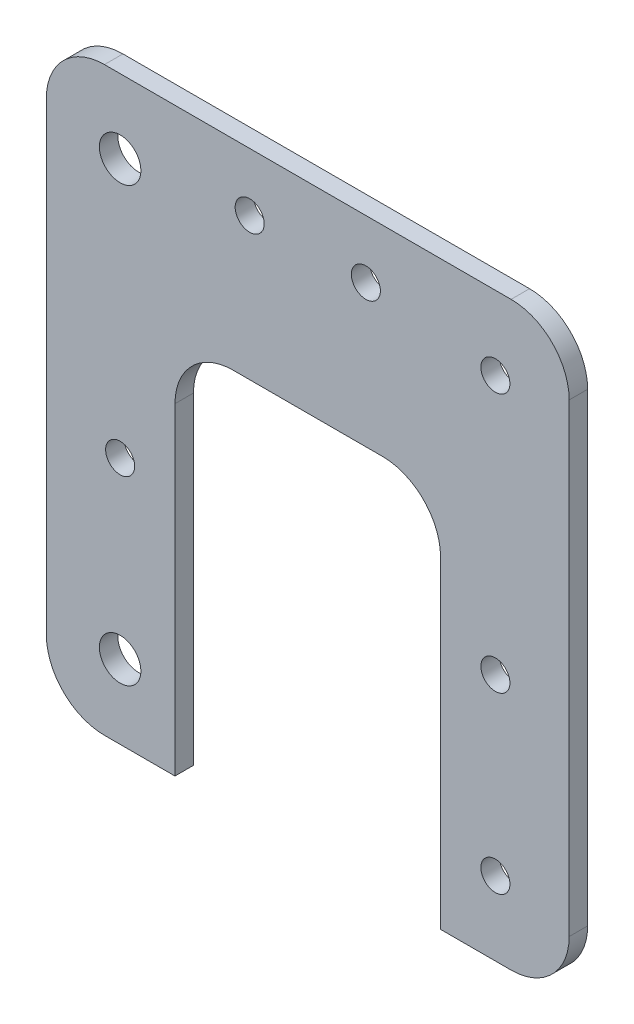
from build123d import *

# Parameters (mm, degrees)
BOSS_EXTRUDE1_START = 19.16
SKETCH1_W           = 90
SKETCH1_H           = 100
SKETCH1_R           = 2.5
SKETCH1_R_2         = 3.57
BOSS_EXTRUDE1_DEPTH = 3.18
SKETCH2_W           = 45.72
SKETCH2_H           = 65.511870912
CUT_EXTRUDE1_DEPTH  = 72.134467033
FILLET1_R           = 10
SKETCH3_R           = 2.5
CUT_EXTRUDE2_DEPTH  = 72.134467033


with BuildPart() as part:
    # Sketch1 → Boss-Extrude1 (new body)
    with BuildSketch(Plane.XY.offset(BOSS_EXTRUDE1_START)):
        with Locations((0, -5)):
            Rectangle(SKETCH1_W, SKETCH1_H)
        with Locations((32.3, -12.3)):
            Circle(SKETCH1_R, mode=Mode.SUBTRACT)
        with Locations((32.3, -42.3)):
            Circle(SKETCH1_R, mode=Mode.SUBTRACT)
        with Locations((-32.3, -42.3)):
            Circle(SKETCH1_R_2, mode=Mode.SUBTRACT)
        with Locations((-32.3, -12.3)):
            Circle(SKETCH1_R, mode=Mode.SUBTRACT)
        with Locations((-32.3, 32.3)):
            Circle(SKETCH1_R_2, mode=Mode.SUBTRACT)
        with Locations((32.3, 32.3)):
            Circle(SKETCH1_R, mode=Mode.SUBTRACT)
    extrude(amount=-BOSS_EXTRUDE1_DEPTH)

    # Sketch2 → Cut-Extrude1 (cut, through all)
    with BuildSketch(Plane(origin=(0, 0, 15.98), x_dir=(-1, 0, 0), z_dir=(0, 0, -1))):
        with Locations((0, -22.244064544)):
            Rectangle(SKETCH2_W, SKETCH2_H)
    extrude(amount=-CUT_EXTRUDE1_DEPTH, mode=Mode.SUBTRACT)

    # Fillet1
    fillet1_edges = [part.edges().sort_by_distance(p)[0] for p in [
        (45, -55, 17.57),
        (-45, -55, 17.57),
        (-45, 45, 17.57),
        (45, 45, 17.57),
        (-22.86, 10.511870912, 17.57),
        (22.86, 10.511870912, 17.57),
    ]]
    fillet(fillet1_edges, radius=FILLET1_R)

    # Sketch3 → Cut-Extrude2 (cut, through all)
    with BuildSketch(Plane.XY.offset(19.16)):
        with Locations((10, 35)):
            Circle(SKETCH3_R)
        with Locations((-10, 35)):
            Circle(SKETCH3_R)
    extrude(amount=-CUT_EXTRUDE2_DEPTH, mode=Mode.SUBTRACT)


solid = part.part
